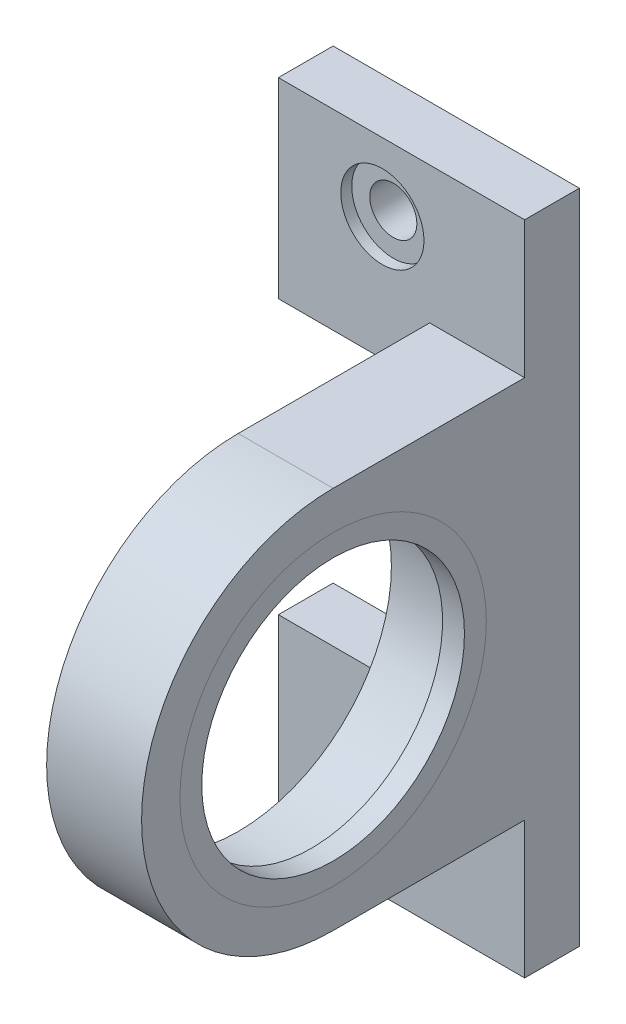
from build123d import *

# Parameters (mm, degrees)
SKETCH_2_W                     = 45
SKETCH_2_H                     = 60
SKETCH_2_W_2                   = 27.647058823
SKETCH_2_H_2                   = 25
EXTRUDE_2_DEPTH                = 5
SKETCH_4_W                     = 8.676470589
SKETCH_4_H                     = 35
SKETCH_4_W_2                   = 8.676470588
EXTRUDE_15_DEPTH               = 35
CUT_EXTRUDE_1_DEPTH            = 45
SKETCH_6_R                     = 14
CUT_EXTRUDE_2_DEPTH            = 45
FILLET_1_R                     = 5
SKETCH_7_R                     = 15
SKETCH_7_R_2                   = 13
EXTRUDE_16_DEPTH               = 1
SPLIT_BODIES_1_SURFACE_1_BACK  = 86
SPLIT_BODIES_1_SURFACE_1_DEPTH = 172
SPLIT_BODIES_1_SURFACE_2_BACK  = 86
SPLIT_BODIES_1_SURFACE_2_DEPTH = 172
HOLE_WIZARD_1_D                = 4.3
HOLE_WIZARD_1_DEPTH            = 5
HOLE_WIZARD_1_CBORE_D          = 7.6
HOLE_WIZARD_1_CBORE_DEPTH      = 1
HOLE_WIZARD_1_TIP              = 1.291850331
SKETCH_14_R                    = 14
EXTRUDE_18_DEPTH               = 2
SKETCH_15_R                    = 12
CUT_EXTRUDE_3_DEPTH            = 3


with BuildPart() as part:
    # 草图2 → 凸台-拉伸2 (new body)
    with BuildSketch(Plane.XY):
        with Locations((7.726423565, -5.661764706)):
            Rectangle(SKETCH_2_W, SKETCH_2_H)
        with Locations((7.726423565, -5.661764706)):
            Rectangle(SKETCH_2_W_2, SKETCH_2_H_2, mode=Mode.SUBTRACT)
    extrude(amount=EXTRUDE_2_DEPTH)

    # 草图4 → 凸台-拉伸15 (add)
    with BuildSketch(Plane.XY.offset(5)):
        with Locations((-10.435341141, -5.661764706)):
            Rectangle(SKETCH_4_W, SKETCH_4_H)
        with Locations((25.888188271, -5.661764706)):
            Rectangle(SKETCH_4_W_2, SKETCH_4_H)
    extrude(amount=EXTRUDE_15_DEPTH)

    # 草图5 → 切除-拉伸1 (cut)
    with BuildSketch(Plane.ZY.offset(14.773576435)):
        with BuildLine():
            ThreePointArc((22.5, 11.838235294), (34.874368671, 6.712603965), (40, -5.661764706))
            Line((40, -5.661764706), (40, 11.838235294))
            Line((40, 11.838235294), (22.5, 11.838235294))
        make_face()
        with BuildLine():
            Line((40, -23.161764706), (40, -5.661764706))
            ThreePointArc((40, -5.661764706), (34.874368671, -18.036133377), (22.5, -23.161764706))
            Line((22.5, -23.161764706), (40, -23.161764706))
        make_face()
    extrude(amount=-CUT_EXTRUDE_1_DEPTH, mode=Mode.SUBTRACT)

    # 草图6 → 切除-拉伸2 (cut)
    with BuildSketch(Plane.ZY.offset(14.773576435)):
        with Locations((22.5, -5.661764706)):
            Circle(SKETCH_6_R)
    extrude(amount=-CUT_EXTRUDE_2_DEPTH, mode=Mode.SUBTRACT)

    # 圆角1
    fillet_1_edges = [part.edges().sort_by_distance(p)[0] for p in [
        (-6.097105846, 6.838235294, 2.5),
        (21.549952977, 6.838235294, 2.5),
        (-6.097105846, -18.161764706, 2.5),
        (21.549952977, -18.161764706, 2.5),
    ]]
    fillet(fillet_1_edges, radius=FILLET_1_R)

    # 草图7 → 凸台-拉伸16 (add)
    with BuildSketch(Plane(origin=(-6.097105846, 0, 0), x_dir=(0, 0, -1), z_dir=(1, 0, 0))):
        with Locations((-22.5, -5.661764706)):
            Circle(SKETCH_7_R)
        with Locations((-22.5, -5.661764706)):
            Circle(SKETCH_7_R_2, mode=Mode.SUBTRACT)
    extrude(amount=-EXTRUDE_16_DEPTH)


with BuildPart() as body_2:
    # Split Bodies 1: the piece behind the surface
    add(part.part)
    # Split Bodies 1 surface: a surface, the sketch's curves swept straight by 172 mm
    with BuildLine(Plane.XY.offset(5).offset(-SPLIT_BODIES_1_SURFACE_1_BACK), mode=Mode.PRIVATE) as split_bodies_1_surface_1_path:
        Line((7.726423565, 24.338235294), (7.726423565, -35.661764706))
    split_bodies_1_surface_1 = Shell.extrude(split_bodies_1_surface_1_path.wire(), (0 * SPLIT_BODIES_1_SURFACE_1_DEPTH, 0 * SPLIT_BODIES_1_SURFACE_1_DEPTH, 1 * SPLIT_BODIES_1_SURFACE_1_DEPTH))
    split(bisect_by=split_bodies_1_surface_1, keep=Keep.BOTTOM)


with BuildPart() as part_1:
    add(part.part)

    # Split Bodies 1: split by a surface, the side it looks to stays
    # Split Bodies 1 surface: a surface, the sketch's curves swept straight by 172 mm
    with BuildLine(Plane.XY.offset(5).offset(-SPLIT_BODIES_1_SURFACE_2_BACK), mode=Mode.PRIVATE) as split_bodies_1_surface_2_path:
        Line((7.726423565, 24.338235294), (7.726423565, -35.661764706))
    split_bodies_1_surface_2 = Shell.extrude(split_bodies_1_surface_2_path.wire(), (0 * SPLIT_BODIES_1_SURFACE_2_DEPTH, 0 * SPLIT_BODIES_1_SURFACE_2_DEPTH, 1 * SPLIT_BODIES_1_SURFACE_2_DEPTH))
    split(bisect_by=split_bodies_1_surface_2, keep=Keep.TOP)

    # 打孔尺寸(%根据六角头螺)栓 全螺纹的类型1
    with Locations(Plane(origin=(17.226423565, 18.088235294, 5), x_dir=(1, 0, 0), z_dir=(0, 0, 1))):
        with Locations((0, 0), (0, -47.5)):
            CounterBoreHole(HOLE_WIZARD_1_D / 2, HOLE_WIZARD_1_CBORE_D / 2, HOLE_WIZARD_1_CBORE_DEPTH, depth=HOLE_WIZARD_1_DEPTH)
            with Locations((0, 0, -(HOLE_WIZARD_1_DEPTH + HOLE_WIZARD_1_TIP / 2))):  # 118° drill point
                Cone(0, HOLE_WIZARD_1_D / 2, HOLE_WIZARD_1_TIP, mode=Mode.SUBTRACT)


with BuildPart() as body_2_2:
    # 草图14 → 凸台-拉伸18 (new body)
    with BuildSketch(Plane(origin=(30.226423565, 0, 0), x_dir=(0, 0, -1), z_dir=(1, 0, 0))):
        with Locations((-22.5, -5.661764706)):
            Circle(SKETCH_14_R)
    extrude(amount=-EXTRUDE_18_DEPTH)

    # 草图15 → 切除-拉伸3 (cut)
    with BuildSketch(Plane.ZY.offset(-28.226423565)):
        with Locations((22.5, -5.661764706)):
            Circle(SKETCH_15_R)
    extrude(amount=-CUT_EXTRUDE_3_DEPTH, mode=Mode.SUBTRACT)


solid = Compound([part_1.part, body_2_2.part])
